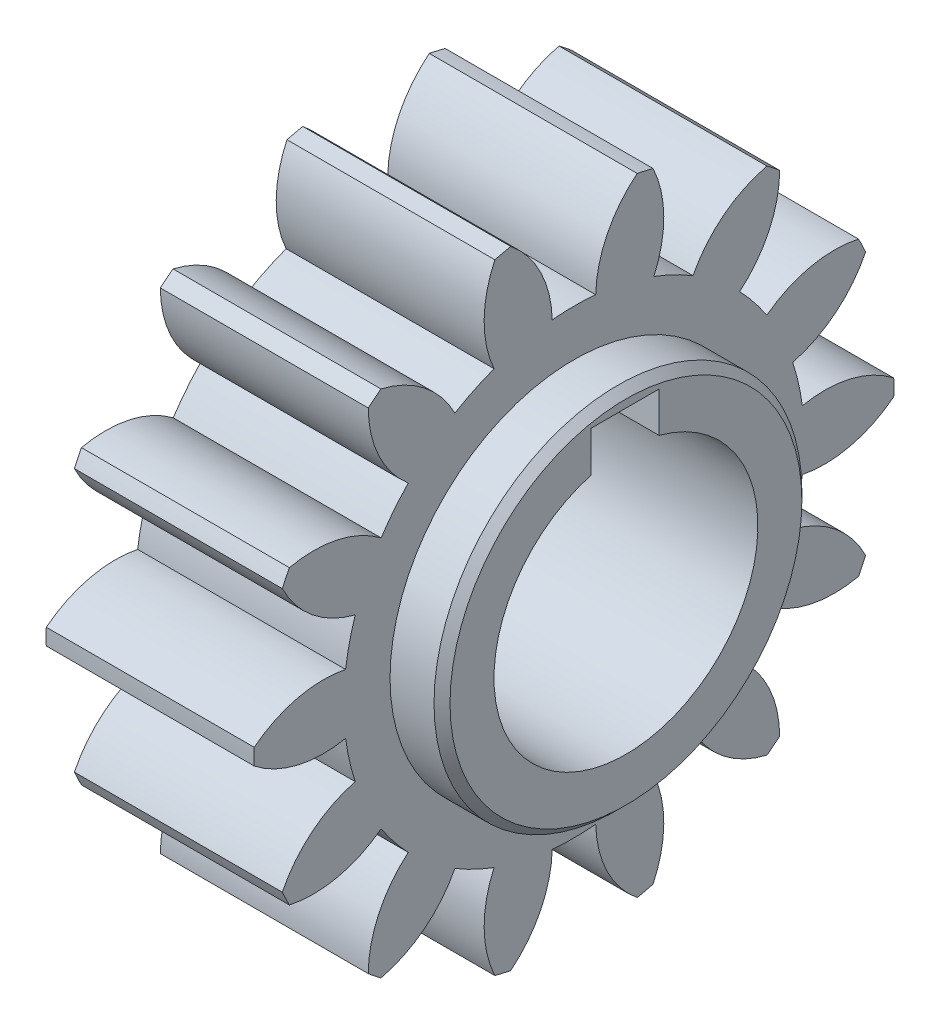
from build123d import *

# Parameters (mm, degrees)
BASPROSKE_W         = 6.604
BASPROSKE_H         = 10.16
TOOTHCUT_DEPTH      = 16.813412535
TEETHCUTS_COUNT     = 14
TEETHCUTS_ANGLE     = 334.285714286
BORSKE_R            = 4.191
BORE_DEPTH          = 50.8000508
BOSS_EXTRUDE1_START = 1.651
SKETCH1_R           = 5.842
SKETCH1_R_2         = 4.191
BOSS_EXTRUDE1_DEPTH = 1.651
SKETCH2_W           = 2.159
SKETCH2_H           = 5.334
CUT_EXTRUDE1_DEPTH  = 17.448750705
CHAMFER1_SIZE       = 0.254


with BuildPart() as part:
    # BasProSke → Base-Revolve (revolve)
    with BuildSketch(Plane(origin=(0, 0, 0), x_dir=(1, 0, 0), z_dir=(0, 1, 0))):
        with Locations((3.302, 5.08)):
            Rectangle(BASPROSKE_W, BASPROSKE_H)
    revolve(axis=Axis((-10, 0, 0), (1, 0, 0)))

    # TooCutSke → ToothCut (cut, through all)
    with BuildSketch(Plane(origin=(0, 0, 0), x_dir=(0, 0, -1), z_dir=(1, 0, 0))):
        with BuildLine():
            ThreePointArc((0.690270933, 7.282559789), (0, 7.3152), (-0.690270933, 7.282559789))
            ThreePointArc((-0.690270933, 7.282559789), (-1.062455419, 8.780807329), (-2.034499207, 9.980139585))
            ThreePointArc((-2.034499207, 9.980139585), (0, 10.1854), (2.034499207, 9.980139585))
            ThreePointArc((2.034499207, 9.980139585), (1.062455419, 8.780807329), (0.690270933, 7.282559789))
        make_face()
    toothcut = extrude(amount=TOOTHCUT_DEPTH, mode=Mode.SUBTRACT)

    # TeethCuts: ToothCut ×14 about axis
    teethcuts_axis = Axis((-10, 0, 0), (1, 0, 0))
    for i in range(1, TEETHCUTS_COUNT):
        add(toothcut.rotate(teethcuts_axis, i * TEETHCUTS_ANGLE / (TEETHCUTS_COUNT - 1)), mode=Mode.SUBTRACT)

    # BorSke → Bore (cut, symmetric)
    with BuildSketch(Plane(origin=(0, 0, 0), x_dir=(0, 0, -1), z_dir=(1, 0, 0))):
        Circle(BORSKE_R)
    extrude(amount=BORE_DEPTH, both=True, mode=Mode.SUBTRACT)

    # Sketch1 → Boss-Extrude1 (add)
    with BuildSketch(Plane(origin=(6.604, 0, 0), x_dir=(0, 0, -1), z_dir=(1, 0, 0)).offset(BOSS_EXTRUDE1_START)):
        Circle(SKETCH1_R)
        Circle(SKETCH1_R_2, mode=Mode.SUBTRACT)
    extrude(amount=-BOSS_EXTRUDE1_DEPTH)

    # Sketch2 → Cut-Extrude1 (cut, through all)
    with BuildSketch(Plane.ZY):
        with Locations((0.026405968, 2.667)):
            Rectangle(SKETCH2_W, SKETCH2_H)
    extrude(amount=-CUT_EXTRUDE1_DEPTH, mode=Mode.SUBTRACT)

    # Chamfer1
    chamfer1_edges = [part.edges().sort_by_distance(p)[0] for p in [
        (8.255, 0, 5.842),
    ]]
    chamfer(chamfer1_edges, length=CHAMFER1_SIZE)


solid = part.part
